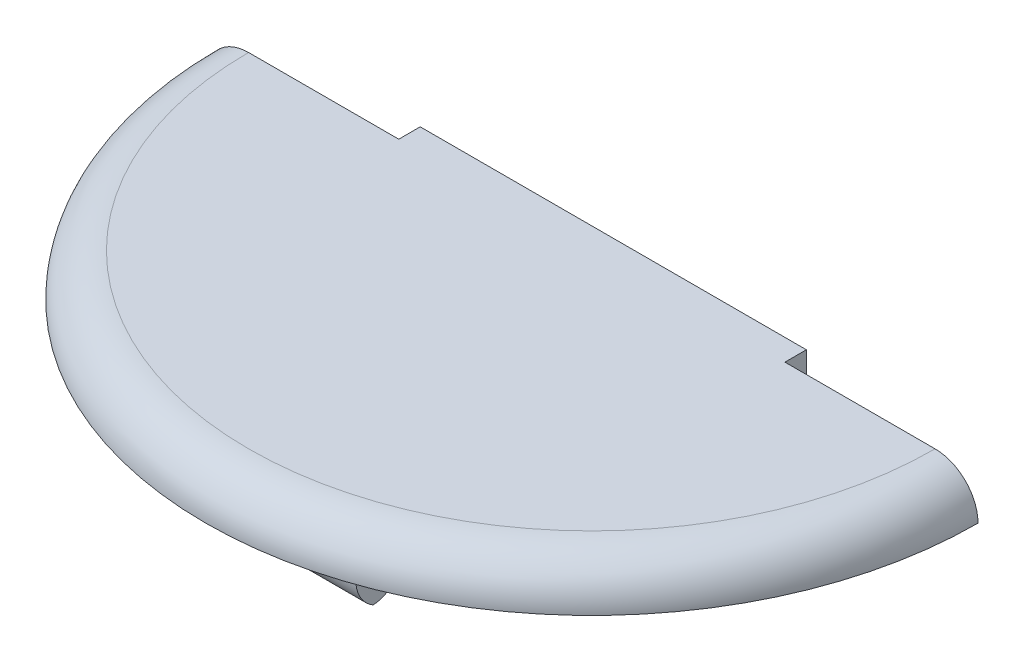
from build123d import *

# Parameters (mm, degrees)
CUT_EXTRUDE1_DEPTH           = 5
CUT_EXTRUDE3_DEPTH           = 45
SKETCH8_R                    = 43
CUT_EXTRUDE4_DEPTH           = 32
SKETCH9_R                    = 32
SKETCH9_R_2                  = 24.5
CUT_EXTRUDE5_DEPTH           = 14
SKETCH10_R                   = 26
CUT_EXTRUDE6_DEPTH           = 14
FILLET1_R                    = 7
FILLET2_R                    = 7
SKETCH12_W                   = 6.590120242
SKETCH12_H                   = 30.5
CUT_REVOLVE1_ANGLE           = 60
CUT_REVOLVE1_OTHER_WAY_ANGLE = 60
CUT_EXTRUDE12_DEPTH          = 5
SKETCH18_W                   = 13
SKETCH18_H                   = 8
CUT_EXTRUDE13_DEPTH          = 5
INTERSECT1_OUTLINE_R         = 45
INTERSECT1_DEPTH             = 79
SKETCH20_W                   = 10
SKETCH20_H                   = 5
BOSS_EXTRUDE1_DEPTH          = 13
BOSS_EXTRUDE3_DEPTH          = 5
SKETCH19_R                   = 1.5
CUT_EXTRUDE14_DEPTH          = 20
SKETCH23_W                   = 25
SKETCH23_H                   = 7
CUT_EXTRUDE15_DEPTH          = 7
SKETCH24_W                   = 45
SKETCH24_H                   = 2.5
CUT_EXTRUDE16_DEPTH          = 5
SKETCH25_R                   = 2.75
CUT_EXTRUDE17_DEPTH          = 5
FILLET4_R                    = 3
FILLET6_R                    = 4


with BuildPart() as part:
    # Sketch1 → Revolve1 (revolve)
    with BuildSketch(Plane.XY, mode=Mode.PRIVATE) as revolve1_sk:
        with BuildLine():
            Line((22.5, 0), (32, 0))
            ThreePointArc((32, 0), (33.414213562, 0.585786438), (34, 2))
            Line((34, 2), (34, 18))
            Line((34, 18), (43, 18))
            ThreePointArc((43, 18), (44.414213562, 18.585786438), (45, 20))
            Line((45, 20), (45, 79))
            ThreePointArc((45, 79), (43.535533906, 82.535533906), (40, 84))
            Line((40, 84), (0, 84))
            Line((0, 84), (0, 18))
            Line((0, 18), (22.5, 18))
            Line((22.5, 18), (22.5, 0))
        make_face()
    revolve(revolve1_sk.sketch.rotate(Axis((0, 2, 0), (0, 1, 0)), 90), axis=Axis((0, 2, 0), (0, 1, 0)))

    # Sketch5 → Cut-Extrude1 (cut)
    with BuildSketch(Plane(origin=(0, 84, 0), x_dir=(1, 0, 0), z_dir=(0, 1, 0))):
        with BuildLine():
            Line((-45, 0), (-40, 0))
            Line((-40, 0), (40, 0))
            Line((40, 0), (45, 0))
            ThreePointArc((45, 0), (0, 45), (-45, 0))
        make_face()
    extrude(amount=-CUT_EXTRUDE1_DEPTH, mode=Mode.SUBTRACT)

    # Sketch7 → Cut-Extrude3 (cut)
    with BuildSketch(Plane.XZ.offset(-18)):
        with BuildLine():
            Line((-21, 0), (21, 0))
            ThreePointArc((21, 0), (0, -21), (-21, 0))
        make_face()
    extrude(amount=-CUT_EXTRUDE3_DEPTH, mode=Mode.SUBTRACT)

    # Sketch8 → Cut-Extrude4 (cut)
    with BuildSketch(Plane(origin=(0, 76.5, 0), x_dir=(1, 0, 0), z_dir=(0, 1, 0))):
        with Locations(Location((0, 0, 0), (0, 0, 270))):
            Circle(SKETCH8_R)
        with BuildLine():
            Line((22.912878475, -2), (-22.912878475, -2))
            ThreePointArc((-22.912878475, -2), (0, 23), (22.912878475, -2))
        make_face(mode=Mode.SUBTRACT)
    extrude(amount=-CUT_EXTRUDE4_DEPTH, mode=Mode.SUBTRACT)

    # Sketch9 → Cut-Extrude5 (cut)
    with BuildSketch(Plane(origin=(0, 2, 0), x_dir=(-1, 0, 0), z_dir=(0, -1, 0))):
        with Locations(Location((0, 0, 0), (0, 0, 90))):
            Circle(SKETCH9_R)
        with Locations(Location((0, 0, 0), (0, 0, 90))):
            Circle(SKETCH9_R_2, mode=Mode.SUBTRACT)
    extrude(amount=-CUT_EXTRUDE5_DEPTH, mode=Mode.SUBTRACT)

    # Sketch10 → Cut-Extrude6 (cut)
    with BuildSketch(Plane(origin=(0, 2, 0), x_dir=(-1, 0, 0), z_dir=(0, -1, 0))):
        Circle(SKETCH10_R)
    extrude(amount=-CUT_EXTRUDE6_DEPTH, mode=Mode.SUBTRACT)

    # Fillet1
    fillet1_edges = [part.edges().sort_by_distance(p)[0] for p in [
        (21, 40.5, 0),
        (-21, 40.5, 0),
    ]]
    fillet(fillet1_edges, radius=FILLET1_R)

    # Fillet2
    fillet2_edges = [part.edges().sort_by_distance(p)[0] for p in [
        (-22.912878475, 60.5, 2),
        (22.912878475, 60.5, 2),
    ]]
    fillet(fillet2_edges, radius=FILLET2_R)

    # Sketch12 → Cut-Revolve1 (revolve, cut)
    with BuildSketch(Plane(origin=(0, 0, 0), x_dir=(0, 0, -1), z_dir=(1, 0, 0))):
        with Locations((-40.662298382, 61.25)):
            Rectangle(SKETCH12_W, SKETCH12_H)
    revolve(axis=Axis((0, 99.14944168, 0), (0, 1, 0)), revolution_arc=CUT_REVOLVE1_ANGLE, mode=Mode.SUBTRACT)

    # Sketch12 → Cut-Revolve1 other way (revolve, cut)
    with BuildSketch(Plane(origin=(0, 0, 0), x_dir=(0, 0, -1), z_dir=(1, 0, 0))):
        with Locations((-40.662298382, 61.25)):
            Rectangle(SKETCH12_W, SKETCH12_H)
    revolve(axis=Axis((0, 99.14944168, 0), (0, -1, 0)), revolution_arc=CUT_REVOLVE1_OTHER_WAY_ANGLE, mode=Mode.SUBTRACT)

    # Sketch15 → Cut-Extrude12 (cut)
    with BuildSketch(Plane(origin=(0, 44.5, 0), x_dir=(1, 0, 0), z_dir=(0, 1, 0))):
        with BuildLine():
            Line((-28.124355653, -3.514579578), (-26.124355653, -3.514579578))
            ThreePointArc((-26.124355653, -3.514579578), (-24.710142091, -2.928793141), (-24.124355653, -1.514579578))
            Line((-24.124355653, -1.514579578), (-24.124355653, 8.485420422))
            ThreePointArc((-24.124355653, 8.485420422), (-24.710142091, 9.899633984), (-26.124355653, 10.485420422))
            Line((-26.124355653, 10.485420422), (-28.124355653, 10.485420422))
            ThreePointArc((-28.124355653, 10.485420422), (-29.538569215, 9.899633984), (-30.124355653, 8.485420422))
            Line((-30.124355653, 8.485420422), (-30.124355653, -1.514579578))
            ThreePointArc((-30.124355653, -1.514579578), (-29.538569215, -2.928793141), (-28.124355653, -3.514579578))
        make_face()
    extrude(amount=-CUT_EXTRUDE12_DEPTH, mode=Mode.SUBTRACT)

    # Sketch18 → Cut-Extrude13 (cut)
    with BuildSketch(Plane(origin=(0, 79, 0), x_dir=(1, 0, 0), z_dir=(0, 1, 0))):
        with Locations((0.796512215, 32.951769165)):
            Rectangle(SKETCH18_W, SKETCH18_H)
    extrude(amount=-CUT_EXTRUDE13_DEPTH, mode=Mode.SUBTRACT)

    # Intersect1: read off the stored shape, not the designer's step
    # Intersect1 outline → Intersect1 (cut)
    with BuildSketch(Plane(origin=(0, 0, 0), x_dir=(1, 0, 0), z_dir=(0, 1, 0))):
        Circle(INTERSECT1_OUTLINE_R)
    extrude(amount=INTERSECT1_DEPTH, mode=Mode.SUBTRACT)

    # Sketch20 → Boss-Extrude1 (add)
    with BuildSketch(Plane.XZ.offset(-79)):
        with Locations((0, 30)):
            Rectangle(SKETCH20_W, SKETCH20_H)
    extrude(amount=BOSS_EXTRUDE1_DEPTH)

    # Sketch22 → Boss-Extrude3 (add)
    with BuildSketch(Plane(origin=(0, 0, 0), x_dir=(-1, 0, 0), z_dir=(0, 0, -1))):
        with BuildLine():
            Line((40, 84), (-40, 84))
            ThreePointArc((-40, 84), (-43.535533906, 82.535533906), (-45, 79))
            Line((-45, 79), (45, 79))
            ThreePointArc((45, 79), (43.535533906, 82.535533906), (40, 84))
        make_face()
    extrude(amount=BOSS_EXTRUDE3_DEPTH)

    # Sketch19 → Cut-Extrude14 (cut)
    with BuildSketch(Plane(origin=(0, 0, 0), x_dir=(-1, 0, 0), z_dir=(0, 0, -1))):
        with Locations((0, 81.5)):
            Circle(SKETCH19_R)
        with Locations((-29.45, 81.5)):
            Circle(SKETCH19_R)
        with Locations((29.45, 81.5)):
            Circle(SKETCH19_R)
    extrude(amount=-CUT_EXTRUDE14_DEPTH, mode=Mode.SUBTRACT)

    # Sketch23 → Cut-Extrude15 (cut)
    with BuildSketch(Plane(origin=(0, 84, 0), x_dir=(1, 0, 0), z_dir=(0, 1, 0))):
        with Locations((-35, 3.5)):
            Rectangle(SKETCH23_W, SKETCH23_H)
        with Locations((35, 3.5)):
            Rectangle(SKETCH23_W, SKETCH23_H)
    extrude(amount=-CUT_EXTRUDE15_DEPTH, mode=Mode.SUBTRACT)

    # Sketch24 → Cut-Extrude16 (cut)
    with BuildSketch(Plane(origin=(0, 84, 0), x_dir=(1, 0, 0), z_dir=(0, 1, 0))):
        with Locations((0, 3.75)):
            Rectangle(SKETCH24_W, SKETCH24_H)
    extrude(amount=-CUT_EXTRUDE16_DEPTH, mode=Mode.SUBTRACT)

    # Sketch25 → Cut-Extrude17 (cut)
    with BuildSketch(Plane(origin=(0, 0, 27.5), x_dir=(-1, 0, 0), z_dir=(0, 0, -1))):
        with Locations((0, 70.8)):
            Circle(SKETCH25_R)
    extrude(amount=-CUT_EXTRUDE17_DEPTH, mode=Mode.SUBTRACT)

    # Fillet4
    # the kernel refuses this fillet: 3 mm, written as the material it takes off along each edge
    with BuildSketch(Plane(origin=(12.5, 66, 27.5), x_dir=(0, 1, 0), z_dir=(-1, 0, 0))) as fillet4_piece_1:
        with BuildLine():
            CenterArc((FILLET4_R, -FILLET4_R), FILLET4_R, 90, 90)
            Line((0, -FILLET4_R), (0, 0))
            Line((0, 0), (FILLET4_R, 0))
        make_face()
    extrude(amount=25, mode=Mode.SUBTRACT)

    # Fillet6
    # the kernel refuses this fillet: 4 mm, written as the material it takes off along each edge
    with BuildSketch(Plane(origin=(-13.660254038, 66, 32.5), x_dir=(0, 1, 0), z_dir=(1, 0, 0))) as fillet6_piece_1:
        with BuildLine():
            CenterArc((3.464101615, -4), FILLET6_R, 90, 60)
            Line((0, -2), (0, 0))
            Line((0, 0), (3.464101615, 0))
        make_face()
    extrude(amount=27.320508076, mode=Mode.SUBTRACT)


solid = part.part
